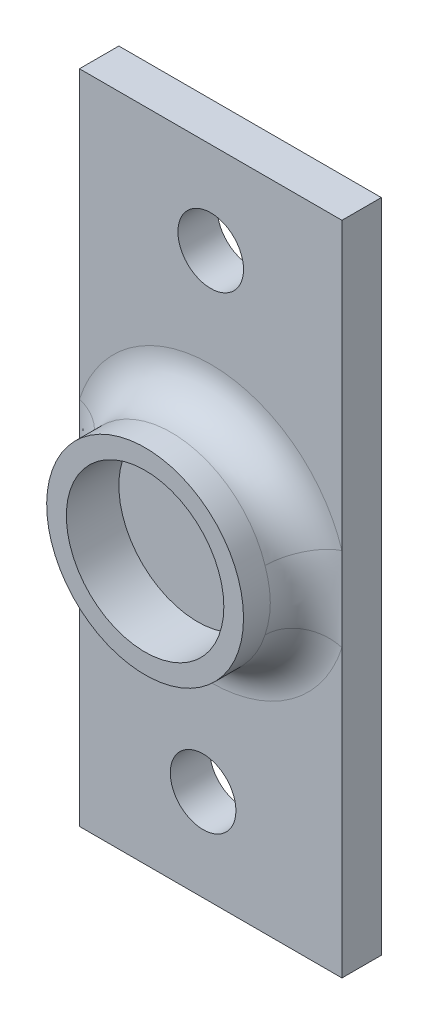
from build123d import *

# Parameters (mm, degrees)
SKETCH_1_W          = 20
SKETCH_1_H          = 50
EXTRUDE_1_DEPTH     = 3
SKETCH_2_R          = 7.5
EXTRUDE_2_DEPTH     = 5
SKETCH_3_R          = 6
CUT_EXTRUDE_1_DEPTH = 4
SKETCH_4_R          = 2.5
CUT_EXTRUDE_2_DEPTH = 3
FILLET_2_R          = 3


with BuildPart() as part:
    # 草图1 → 凸台-拉伸1 (new body)
    with BuildSketch(Plane.XY):
        Rectangle(SKETCH_1_W, SKETCH_1_H)
    extrude(amount=EXTRUDE_1_DEPTH)

    # 草图2 → 凸台-拉伸2 (add)
    with BuildSketch(Plane.XY.offset(3)):
        Circle(SKETCH_2_R)
    extrude(amount=EXTRUDE_2_DEPTH)

    # 草图3 → 切除-拉伸1 (cut)
    with BuildSketch(Plane.XY.offset(8)):
        Circle(SKETCH_3_R)
    extrude(amount=-CUT_EXTRUDE_1_DEPTH, mode=Mode.SUBTRACT)

    # 草图4 → 切除-拉伸2 (cut)
    with BuildSketch(Plane.XY.offset(3)):
        with Locations((0, 18)):
            Circle(SKETCH_4_R)
        with Locations((-0.580661347, -18)):
            Circle(SKETCH_4_R)
    extrude(amount=-CUT_EXTRUDE_2_DEPTH, mode=Mode.SUBTRACT)

    # 圆角2
    fillet_2_edges = [part.edges().sort_by_distance(p)[0] for p in [
        (-7.5, 0, 3),
    ]]
    fillet(fillet_2_edges, radius=FILLET_2_R)


solid = part.part
